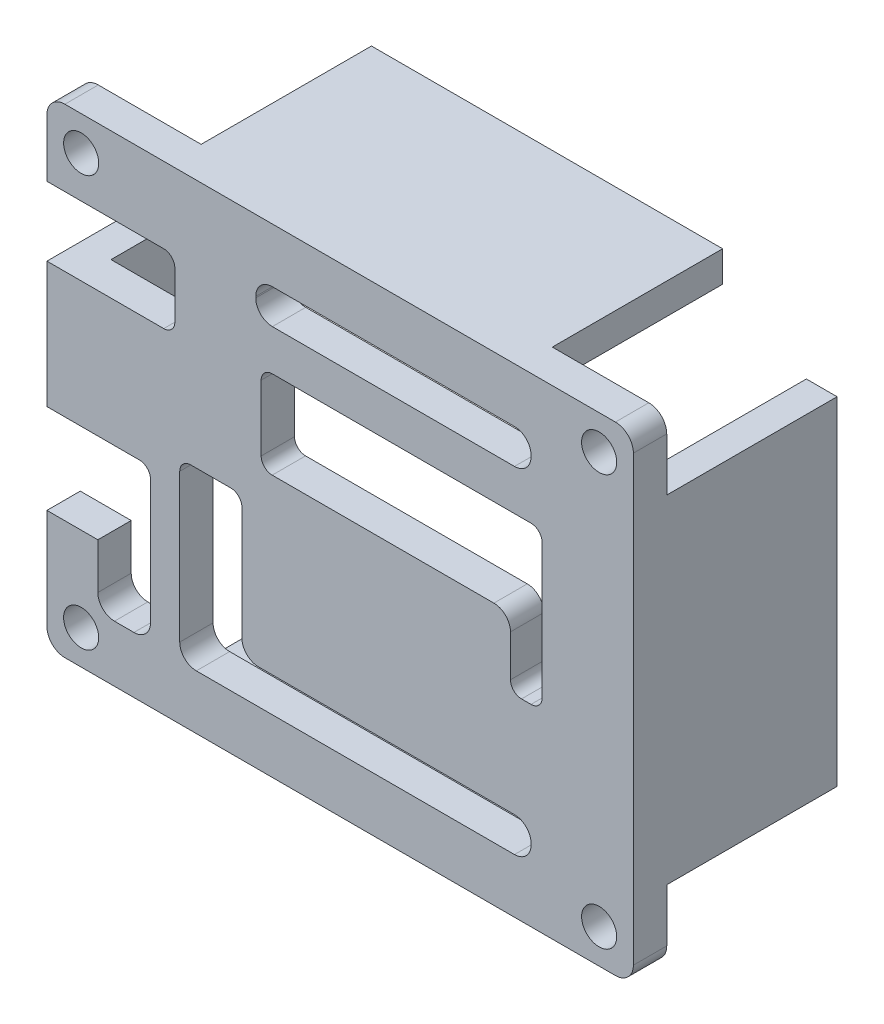
from build123d import *

# Parameters (mm, degrees)
SKETCH1_W           = 84.836
SKETCH1_H           = 69.342
BASE_FLANGE1_DEPTH  = 4.826
SKETCH6_R           = 2.54
CUT_EXTRUDE1_DEPTH  = 10
FILLET1_R           = 2.6
SKETCH7_W           = 18.5
SKETCH7_H           = 10
SKETCH7_W_2         = 39.8249902
SKETCH7_H_2         = 5
CUT_EXTRUDE2_DEPTH  = 4.826
FILLET2_R           = 2.4
FILLET3_R           = 1.6
SKETCH11_W          = 4.445
SKETCH11_H          = 18.2239968
SKETCH11_H_2        = 48.82401137
SKETCH11_W_2        = 50.8
SKETCH11_H_3        = 4.445
BOSS_EXTRUDE1_DEPTH = 24.638


# Sheet-metal steps are written as plain solids
with BuildPart() as part:
    # Sketch1 → Base-Flange1 (new body)
    with BuildSketch(Plane.XY):
        Rectangle(SKETCH1_W, SKETCH1_H)
    extrude(amount=-BASE_FLANGE1_DEPTH)

    # Sketch6 → Cut-Extrude1 (cut)
    with BuildSketch(Plane.XY):
        with Locations((-37.465, 29.718)):
            Circle(SKETCH6_R)
        with Locations(Location((-37.465, -29.718, 0), (0, 0, 180))):
            Circle(SKETCH6_R)
        with Locations((37.465, -29.718)):
            Circle(SKETCH6_R)
        with Locations(Location((37.465, 29.718, 0), (0, 0, 180))):
            Circle(SKETCH6_R)
    extrude(amount=-CUT_EXTRUDE1_DEPTH, mode=Mode.SUBTRACT)

    # Fillet1
    fillet1_edges = [part.edges().sort_by_distance(p)[0] for p in [
        (-42.418, 34.671, -2.413),
        (42.418, 34.671, -2.413),
        (42.418, -34.671, -2.413),
        (-42.418, -34.671, -2.413),
    ]]
    fillet(fillet1_edges, radius=FILLET1_R)

    # Sketch7 → Cut-Extrude2 (cut)
    with BuildSketch(Plane.XY):
        with Locations((-33.168, 18.7119922)):
            Rectangle(SKETCH7_W, SKETCH7_H)
        Polygon((-42.418, -4.5120046), (-27.432, -4.5120046), (-27.432, -26.512012), (-35.052, -26.512012), (-35.052, -17.5120046), (-42.418, -17.5120046), align=None)
        with Locations((7.7044931, 24.3120114)):
            Rectangle(SKETCH7_W_2, SKETCH7_H_2)
        Polygon((-14.2080054, -21.81200997), (-14.2080054, -1.41199997), (-23.2080054, -1.41199997), (-23.2080054, -26.81199997), (27.6169882, -26.81199997), (27.6169882, -21.81200997), align=None)
        Polygon((24.638, 3.195999958), (-11.43, 3.195999958), (-11.43, 15.895999958), (29.21, 15.895999958), (29.21, 3.195999958), (29.21, -6.804000042), (24.638, -6.804000042), align=None)
    extrude(amount=-CUT_EXTRUDE2_DEPTH, mode=Mode.SUBTRACT)

    # Fillet2
    fillet2_edges = [part.edges().sort_by_distance(p)[0] for p in [
        (-12.208002, 21.8120114, -2.413),
        (-12.208002, 26.8120114, -2.413),
        (27.6169882, 26.8120114, -2.413),
        (27.6169882, 21.8120114, -2.413),
        (27.6169882, -21.81200997, -2.413),
        (27.6169882, -26.81199997, -2.413),
        (-23.2080054, -26.81199997, -2.413),
        (-14.2080054, -21.81200997, -2.413),
        (24.638, 3.195999958, -2.413),
        (-27.432, -26.512012, -2.413),
        (-35.052, -26.512012, -2.413),
    ]]
    fillet(fillet2_edges, radius=FILLET2_R)

    # Fillet3
    fillet3_edges = [part.edges().sort_by_distance(p)[0] for p in [
        (-23.2080054, -1.41199997, -2.413),
        (-14.2080054, -1.41199997, -2.413),
        (24.638, -6.804000042, -2.413),
        (-11.43, 3.195999958, -2.413),
        (-11.43, 15.895999958, -2.413),
        (29.21, 15.895999958, -2.413),
        (29.21, -6.804000042, -2.413),
        (-23.918, 23.7119922, -2.413),
        (-23.918, 13.7119922, -2.413),
        (-27.432, -4.5120046, -2.413),
    ]]
    fillet(fillet3_edges, radius=FILLET3_R)

    # Sketch11 → Boss-Extrude1 (add)
    with BuildSketch(Plane(origin=(0, 0, -4.826), x_dir=(-1, 0, 0), z_dir=(0, 0, -1))):
        with Locations((40.1955, 4.5999938)):
            Rectangle(SKETCH11_W, SKETCH11_H)
        with Locations((-40.1955, 5.715e-06)):
            Rectangle(SKETCH11_W, SKETCH11_H_2)
        with Locations((-0.463533105, -32.4485)):
            Rectangle(SKETCH11_W_2, SKETCH11_H_3)
        with Locations((-0.463533105, 32.4485)):
            Rectangle(SKETCH11_W_2, SKETCH11_H_3)
    extrude(amount=BOSS_EXTRUDE1_DEPTH)


solid = part.part
